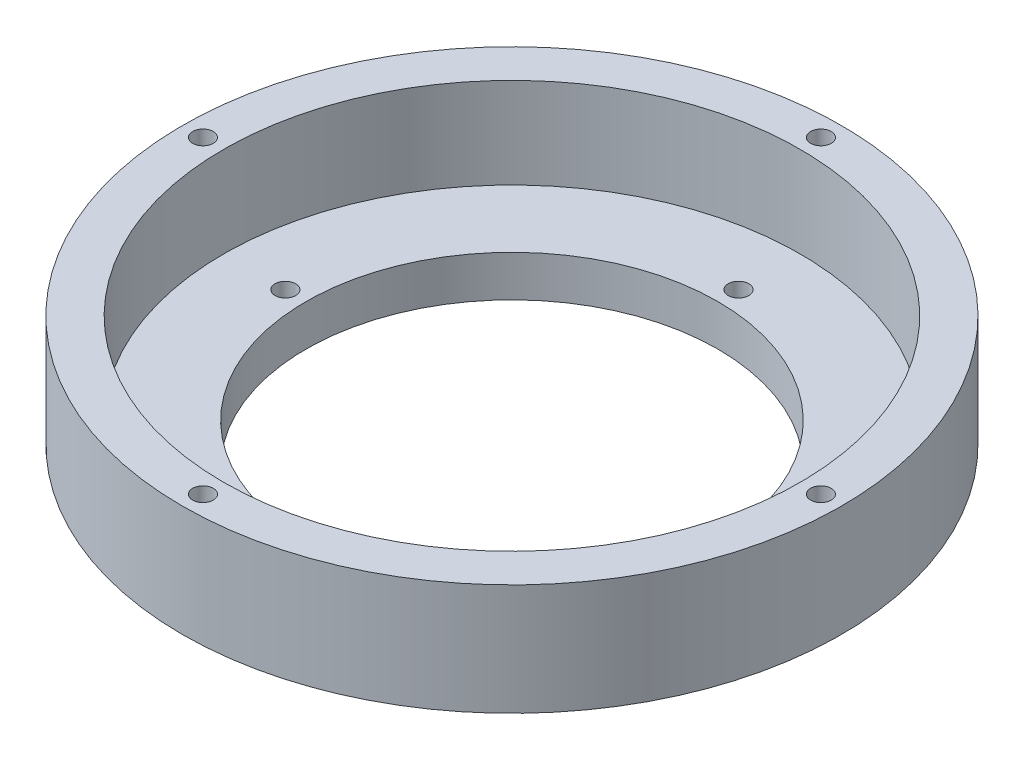
from build123d import *

# Parameters (mm, degrees)
SKETCH2_R           = 60
SKETCH2_R_2         = 50
BOSS_EXTRUDE1_DEPTH = 5
SKETCH7_R           = 80
SKETCH7_R_2         = 50
BOSS_EXTRUDE2_DEPTH = 5
SKETCH8_R           = 80
SKETCH8_R_2         = 70
BOSS_EXTRUDE3_DEPTH = 22
CUT_EXTRUDE3_REACH  = 119.576
SKETCH4_R           = 2.5
SKETCH9_R           = 2.5
CUT_EXTRUDE4_DEPTH  = 10


with BuildPart() as part:
    # Sketch2 → Boss-Extrude1 (new body)
    with BuildSketch(Plane(origin=(0, 0, 0), x_dir=(1, 0, 0), z_dir=(0, 1, 0))):
        Circle(SKETCH2_R)
        Circle(SKETCH2_R_2, mode=Mode.SUBTRACT)
    extrude(amount=BOSS_EXTRUDE1_DEPTH)

    # Sketch7 → Boss-Extrude2 (add)
    with BuildSketch(Plane(origin=(0, 5, 0), x_dir=(1, 0, 0), z_dir=(0, 1, 0))):
        Circle(SKETCH7_R)
        Circle(SKETCH7_R_2, mode=Mode.SUBTRACT)
    extrude(amount=BOSS_EXTRUDE2_DEPTH)

    # Sketch8 → Boss-Extrude3 (add)
    with BuildSketch(Plane(origin=(0, 10, 0), x_dir=(1, 0, 0), z_dir=(0, 1, 0))):
        Circle(SKETCH8_R)
        Circle(SKETCH8_R_2, mode=Mode.SUBTRACT)
    extrude(amount=BOSS_EXTRUDE3_DEPTH)

    # Sketch4 → Cut-Extrude3 (cut, up to next)
    with BuildSketch(Plane.XZ, mode=Mode.PRIVATE) as cut_extrude3_sk1:
        with Locations((-55, 0)):
            Circle(SKETCH4_R)
    cut_extrude3_tool1 = extrude(cut_extrude3_sk1.sketch, amount=-CUT_EXTRUDE3_REACH, mode=Mode.PRIVATE) & part.part
    # Sketch4 → Cut-Extrude3 (cut, up to next)
    with BuildSketch(Plane.XZ, mode=Mode.PRIVATE) as cut_extrude3_sk2:
        with Locations((0, 55)):
            Circle(SKETCH4_R)
    cut_extrude3_tool2 = extrude(cut_extrude3_sk2.sketch, amount=-CUT_EXTRUDE3_REACH, mode=Mode.PRIVATE) & part.part
    # Sketch4 → Cut-Extrude3 (cut, up to next)
    with BuildSketch(Plane.XZ, mode=Mode.PRIVATE) as cut_extrude3_sk3:
        with Locations((0, -55)):
            Circle(SKETCH4_R)
    cut_extrude3_tool3 = extrude(cut_extrude3_sk3.sketch, amount=-CUT_EXTRUDE3_REACH, mode=Mode.PRIVATE) & part.part
    # Sketch4 → Cut-Extrude3 (cut, up to next)
    with BuildSketch(Plane.XZ, mode=Mode.PRIVATE) as cut_extrude3_sk4:
        with Locations((55, 0)):
            Circle(SKETCH4_R)
    cut_extrude3_tool4 = extrude(cut_extrude3_sk4.sketch, amount=-CUT_EXTRUDE3_REACH, mode=Mode.PRIVATE) & part.part
    add(cut_extrude3_tool1.solids().sort_by_distance((-55, 0, 0))[0], mode=Mode.SUBTRACT)
    add(cut_extrude3_tool2.solids().sort_by_distance((0, 0, 55))[0], mode=Mode.SUBTRACT)
    add(cut_extrude3_tool3.solids().sort_by_distance((0, 0, -55))[0], mode=Mode.SUBTRACT)
    add(cut_extrude3_tool4.solids().sort_by_distance((55, 0, 0))[0], mode=Mode.SUBTRACT)

    # Sketch9 → Cut-Extrude4 (cut)
    with BuildSketch(Plane(origin=(0, 32, 0), x_dir=(1, 0, 0), z_dir=(0, 1, 0))):
        with Locations((-75, 0)):
            Circle(SKETCH9_R)
        with Locations((0, 75)):
            Circle(SKETCH9_R)
        with Locations((0, -75)):
            Circle(SKETCH9_R)
        with Locations((75, 0)):
            Circle(SKETCH9_R)
    extrude(amount=-CUT_EXTRUDE4_DEPTH, mode=Mode.SUBTRACT)


solid = part.part
